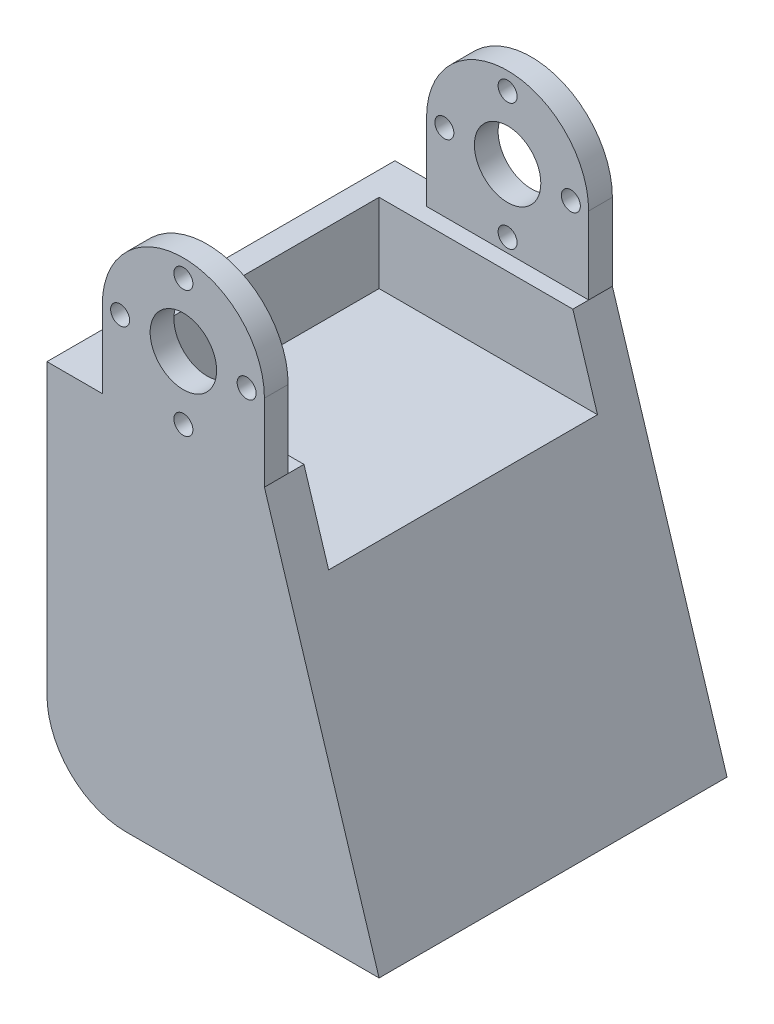
from build123d import *

# Parameters (mm, degrees)
BOSS_EXTRUDE1_DEPTH      = 22
BOSS_EXTRUDE1_DEPTH_BACK = 22
SKETCH2_W                = 38
SKETCH2_H                = 20
CUT_EXTRUDE1_DEPTH       = 105.423416914
SKETCH3_W                = 7
SKETCH3_H                = 44
BOSS_EXTRUDE2_DEPTH      = 65.5
SKETCH23_R               = 5
SKETCH23_R_2             = 1.2
CUT_EXTRUDE2_DEPTH       = 111.605436123
SKETCH24_W               = 28.5
SKETCH24_H               = 34
CUT_EXTRUDE3_DEPTH       = 90.954502389
SKETCH26_R               = 1.2
SKETCH26_R_2             = 5
SKETCH26_R_3             = 1.45
CUT_EXTRUDE6_DEPTH       = 107.330263801
SKETCH27_W               = 29.7
SKETCH27_H               = 35.2
CUT_EXTRUDE8_DEPTH       = 73.137455597
SKETCH29_W               = 7
SKETCH29_H               = 30
CUT_EXTRUDE10_DEPTH      = 74.468530678
CHAMFER2_SIZE            = 5
BOSS_EXTRUDE4_DEPTH      = 22
BOSS_EXTRUDE4_DEPTH_BACK = 22
SKETCH31_W               = 28.5
SKETCH31_H               = 34
CUT_EXTRUDE11_DEPTH      = 10
FILLET1_R                = 10


with BuildPart() as part:
    # Sketch1 → Boss-Extrude1 (new, two sides: drawn at the far end of the back side and taken through both)
    with BuildSketch(Plane.XY.offset(-BOSS_EXTRUDE1_DEPTH_BACK)):
        with BuildLine():
            Line((10.25, -60), (10.25, 0))
            ThreePointArc((10.25, 0), (0, -10.25), (-10.25, 0))
            Line((-10.25, 0), (-10.25, -60))
            Line((-10.25, -60), (-10.25, -100))
            Line((-10.25, -100), (10.25, -100))
            Line((10.25, -100), (10.25, -60))
        make_face()
        with BuildLine():
            Line((10.25, 0), (9.2, 0))
            ThreePointArc((9.2, 0), (8.816088231, -0.879772698), (7.91, -1.196620241))
            ThreePointArc((7.91, -1.196620241), (5.656854249, -5.656854249), (1.196620241, -7.91))
            ThreePointArc((1.196620241, -7.91), (1.199154762, -7.954968281), (1.2, -8))
            ThreePointArc((1.2, -8), (-0.045031719, -9.199154762), (-1.196620241, -7.91))
            ThreePointArc((-1.196620241, -7.91), (-5.656854249, -5.656854249), (-7.91, -1.196620241))
            ThreePointArc((-7.91, -1.196620241), (-8.816088231, -0.879772698), (-9.2, 0))
            Line((-9.2, 0), (-10.25, 0))
            ThreePointArc((-10.25, 0), (0, -10.25), (10.25, 0))
        make_face()
        with BuildLine():
            ThreePointArc((7.91, -1.196620241), (7.120227302, -0.816088231), (6.8, 0))
            Line((6.8, 0), (4.2, 0))
            ThreePointArc((4.2, 0), (0, -4.2), (-4.2, 0))
            Line((-4.2, 0), (-6.8, 0))
            ThreePointArc((-6.8, 0), (-7.120227302, -0.816088231), (-7.91, -1.196620241))
            ThreePointArc((-7.91, -1.196620241), (-5.656854249, -5.656854249), (-1.196620241, -7.91))
            ThreePointArc((-1.196620241, -7.91), (0, -6.8), (1.196620241, -7.91))
            ThreePointArc((1.196620241, -7.91), (5.656854249, -5.656854249), (7.91, -1.196620241))
        make_face()
        with BuildLine():
            Line((4.2, 0), (6.8, 0))
            ThreePointArc((6.8, 0), (7.120227302, 0.816088231), (7.91, 1.196620241))
            ThreePointArc((7.91, 1.196620241), (5.656854249, 5.656854249), (1.196620241, 7.91))
            ThreePointArc((1.196620241, 7.91), (0, 6.8), (-1.196620241, 7.91))
            ThreePointArc((-1.196620241, 7.91), (-5.656854249, 5.656854249), (-7.91, 1.196620241))
            ThreePointArc((-7.91, 1.196620241), (-7.120227302, 0.816088231), (-6.8, 0))
            Line((-6.8, 0), (-4.2, 0))
            ThreePointArc((-4.2, 0), (0, 4.2), (4.2, 0))
        make_face()
        with BuildLine():
            ThreePointArc((7.91, 1.196620241), (8.816088231, 0.879772698), (9.2, 0))
            Line((9.2, 0), (10.25, 0))
            ThreePointArc((10.25, 0), (0, 10.25), (-10.25, 0))
            Line((-10.25, 0), (-9.2, 0))
            ThreePointArc((-9.2, 0), (-8.816088231, 0.879772698), (-7.91, 1.196620241))
            ThreePointArc((-7.91, 1.196620241), (-5.656854249, 5.656854249), (-1.196620241, 7.91))
            ThreePointArc((-1.196620241, 7.91), (-0.045031719, 9.199154762), (1.2, 8))
            ThreePointArc((1.2, 8), (1.199154762, 7.954968281), (1.196620241, 7.91))
            ThreePointArc((1.196620241, 7.91), (5.656854249, 5.656854249), (7.91, 1.196620241))
        make_face()
    extrude(amount=BOSS_EXTRUDE1_DEPTH + BOSS_EXTRUDE1_DEPTH_BACK)

    # Sketch2 → Cut-Extrude1 (cut, through all)
    with BuildSketch(Plane.ZY.offset(10.25)):
        with Locations((0, 0.25)):
            Rectangle(SKETCH2_W, SKETCH2_H)
    extrude(amount=-CUT_EXTRUDE1_DEPTH, mode=Mode.SUBTRACT)

    # Sketch3 → Boss-Extrude2 (add)
    with BuildSketch(Plane(origin=(0, -9.75, 0), x_dir=(1, 0, 0), z_dir=(0, 1, 0))):
        with Locations((-13.75, 0)):
            Rectangle(SKETCH3_W, SKETCH3_H)
        with Locations((13.75, 0)):
            Rectangle(SKETCH3_W, SKETCH3_H)
    extrude(amount=-BOSS_EXTRUDE2_DEPTH)

    # Sketch23 → Cut-Extrude2 (cut, through all)
    with BuildSketch(Plane.XY.offset(22)):
        with BuildLine():
            Line((-10.25, -100), (10.25, -100))
            Line((10.25, -100), (10.25, -85))
            ThreePointArc((10.25, -85), (0, -95.25), (-10.25, -85))
            Line((-10.25, -85), (-10.25, -100))
        make_face()
        with Locations((0, -85)):
            Circle(SKETCH23_R)
        with Locations((8, -85)):
            Circle(SKETCH23_R_2)
        with Locations((0, -77)):
            Circle(SKETCH23_R_2)
        with Locations((0, -93)):
            Circle(SKETCH23_R_2)
        with Locations((-8, -85)):
            Circle(SKETCH23_R_2)
    extrude(amount=-CUT_EXTRUDE2_DEPTH, mode=Mode.SUBTRACT)

    # Sketch24 → Cut-Extrude3 (cut, through all)
    with BuildSketch(Plane(origin=(0, -9.75, 0), x_dir=(1, 0, 0), z_dir=(0, 1, 0))):
        Rectangle(SKETCH24_W, SKETCH24_H)
    extrude(amount=-CUT_EXTRUDE3_DEPTH, mode=Mode.SUBTRACT)

    # Sketch26 → Cut-Extrude6 (cut, through all)
    # profile 1 of 5: a face of its own
    with BuildSketch(Plane.XY.offset(22)):
        with BuildLine():
            Line((10.25, -75.25), (14.25, -75.25))
            Line((14.25, -75.25), (14.25, -56.53282359))
            Line((14.25, -56.53282359), (14.25, -56.25))
            Line((14.25, -56.25), (-14.25, -56.25))
            Line((-14.25, -56.25), (-14.25, -56.53282359))
            Line((-14.25, -56.53282359), (-14.25, -75.25))
            Line((-14.25, -75.25), (-10.25, -75.25))
            Line((-10.25, -75.25), (-10.25, -85))
            ThreePointArc((-10.25, -85), (0, -95.25), (10.25, -85))
            Line((10.25, -85), (10.25, -75.25))
        make_face()
        with Locations((-8, -85)):
            Circle(SKETCH26_R, mode=Mode.SUBTRACT)
        with Locations((0, -85)):
            Circle(SKETCH26_R_2, mode=Mode.SUBTRACT)
        with Locations((0, -77)):
            Circle(SKETCH26_R, mode=Mode.SUBTRACT)
        with Locations((0, -93)):
            Circle(SKETCH26_R, mode=Mode.SUBTRACT)
        with Locations((8, -85)):
            Circle(SKETCH26_R, mode=Mode.SUBTRACT)
    # profile 2 of 5: a face of its own
    with BuildSketch(Plane.XY.offset(22)):
        Polygon((-17.25, -75.25), (-14.25, -75.25), (-14.25, -56.53282359), (-14.25, -56.25), (-17.25, -56.25), align=None)
    # profile 3 of 5: a face of its own
    with BuildSketch(Plane.XY.offset(22)):
        Polygon((14.25, -56.53282359), (14.25, -75.25), (17.25, -75.25), (17.25, -56.25), (14.25, -56.25), align=None)
    # profile 4 of 5: a face of its own
    with BuildSketch(Plane.XY.offset(22)):
        with Locations((-11, -53)):
            Circle(SKETCH26_R_3)
    # profile 5 of 5: a face of its own
    with BuildSketch(Plane.XY.offset(22)):
        with Locations((11, -53)):
            Circle(SKETCH26_R_3)
    extrude(amount=-CUT_EXTRUDE6_DEPTH, mode=Mode.SUBTRACT)

    # Sketch27 → Cut-Extrude8 (cut, through all)
    with BuildSketch(Plane.XZ.offset(56.25)):
        Rectangle(SKETCH27_W, SKETCH27_H)
    extrude(amount=-CUT_EXTRUDE8_DEPTH, mode=Mode.SUBTRACT)

    # Sketch29 → Cut-Extrude10 (cut, through all)
    with BuildSketch(Plane(origin=(0, 0, -22), x_dir=(-1, 0, 0), z_dir=(0, 0, -1))):
        with Locations((-13.75, -24.75)):
            Rectangle(SKETCH29_W, SKETCH29_H)
    extrude(amount=-CUT_EXTRUDE10_DEPTH, mode=Mode.SUBTRACT)

    # Chamfer2
    # the kernel refuses this chamfer: 5 mm, written as the material it takes off along each edge
    with BuildSketch(Plane(origin=(-17.25, -56.25, 34.85841494), x_dir=(0.9996219169112968, -0.027495876610586327, 0), z_dir=(0, 0, -1))) as chamfer2_piece_1:
        Polygon((CHAMFER2_SIZE * 0.999621916911, -CHAMFER2_SIZE * 0.0274958766106), (-CHAMFER2_SIZE * 0.0274958766106, -CHAMFER2_SIZE * 0.999621916911), (0, 0), align=None)
    extrude(amount=69.71682988, mode=Mode.SUBTRACT)

    # Sketch30 → Boss-Extrude4 (add, two sides: drawn at the far end of the back side and taken through both)
    with BuildSketch(Plane.XY.offset(-BOSS_EXTRUDE4_DEPTH_BACK)):
        Polygon((24.75, -56.25), (17.25, -32.198275862), (17.25, -56.25), align=None)
        Polygon((17.25, -32.198275862), (10.25, -9.75), (-17.25, -9.75), (-17.25, -56.25), (17.25, -56.25), align=None)
    extrude(amount=BOSS_EXTRUDE4_DEPTH + BOSS_EXTRUDE4_DEPTH_BACK)

    # Sketch31 → Cut-Extrude11 (cut)
    with BuildSketch(Plane(origin=(0, -9.75, 0), x_dir=(1, 0, 0), z_dir=(0, 1, 0))):
        Rectangle(SKETCH31_W, SKETCH31_H)
    extrude(amount=-CUT_EXTRUDE11_DEPTH, mode=Mode.SUBTRACT)

    # Fillet1
    fillet1_edges = [part.edges().sort_by_distance(p)[0] for p in [
        (-17.25, -56.25, 0),
    ]]
    fillet(fillet1_edges, radius=FILLET1_R)


solid = part.part
